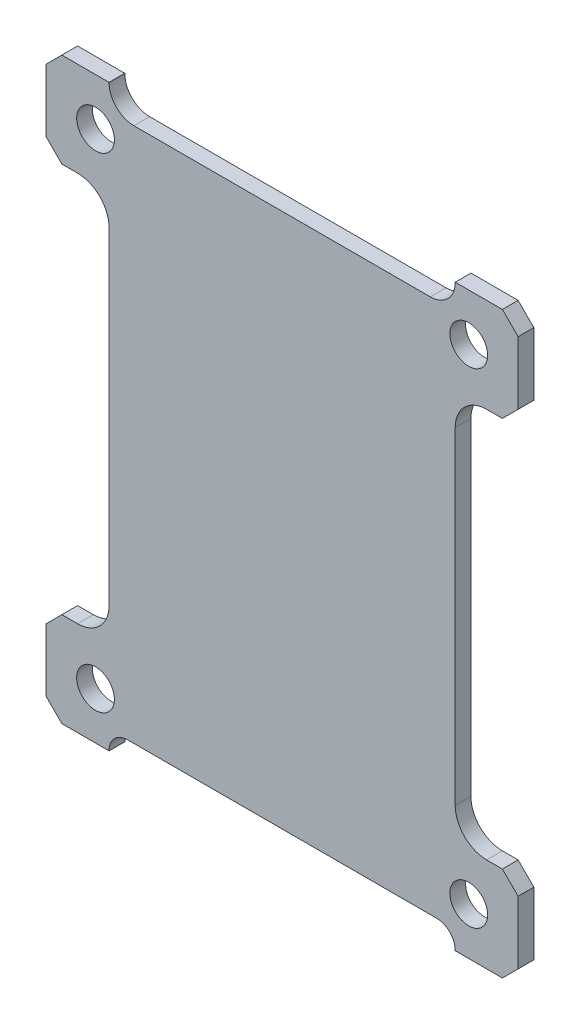
from build123d import *

# Parameters (mm, degrees)
ESBO_O1_R                       = 0.6
RESSALTO_EXTRUS_O1_DEPTH        = 0.5
ESBO_O3_W                       = 4
ESBO_O3_H                       = 5
RESSALTO_EXTRUS_O2_DEPTH        = 1.5
ESBO_O4_W                       = 1
ESBO_O4_H                       = 0.6
RESSALTO_EXTRUS_O3_DEPTH        = 1
CHANFRO1_SIZE                   = 0.8
PADR_O_LINEAR1_COUNT            = 4
PADR_O_LINEAR1_PITCH            = 1.25
CHANFRO1_OF_PADR_O_LINEAR1_SIZE = 0.8
ESPELHAR1_START                 = -1.1
ESPELHAR1_DEPTH                 = 0.6
ESPELHAR1_START_2               = 0.15
ESPELHAR1_2_DEPTH               = 0.6
ESPELHAR1_START_3               = 1.4
ESPELHAR1_3_DEPTH               = 0.6
ESPELHAR1_START_4               = 2.65
ESPELHAR1_4_DEPTH               = 0.6
CHANFRO2_SIZE                   = 0.2


# Read off the part's stored shape, not the designer's step: Espelhar1
with BuildPart() as part:
    # Esboço1 → Ressalto-extrusão1 (new body)
    with BuildSketch(Plane.XY):
        with BuildLine():
            Line((-7, 9.2), (-5.5, 9.2))
            Line((-5.5, 9.2), (-5.5, 9.19))
            ThreePointArc((-5.5, 9.19), (-5.268614357, 8.631385643), (-4.71, 8.4))
            Line((-4.71, 8.4), (4.71, 8.4))
            ThreePointArc((4.71, 8.4), (5.268614357, 8.631385643), (5.5, 9.19))
            Line((5.5, 9.19), (5.5, 9.2))
            Line((5.5, 9.2), (7, 9.2))
            Line((7, 9.2), (7.5, 8.7))
            Line((7.5, 8.7), (7.5, 6.7))
            Line((7.5, 6.7), (7, 6.2))
            Line((7, 6.2), (6.5, 6.2))
            ThreePointArc((6.5, 6.2), (5.792893219, 5.907106781), (5.5, 5.2))
            Line((5.5, 5.2), (5.5, -5.2))
            ThreePointArc((5.5, -5.2), (5.792893219, -5.907106781), (6.5, -6.2))
            Line((6.5, -6.2), (7, -6.2))
            Line((7, -6.2), (7.5, -6.7))
            Line((7.5, -6.7), (7.5, -8.7))
            Line((7.5, -8.7), (7, -9.2))
            Line((7, -9.2), (5.5, -9.2))
            Line((5.5, -9.2), (5.5, -9.19))
            ThreePointArc((5.5, -9.19), (5.327193001, -8.772806999), (4.91, -8.6))
            Line((4.91, -8.6), (-4.91, -8.6))
            ThreePointArc((-4.91, -8.6), (-5.327193001, -8.772806999), (-5.5, -9.19))
            Line((-5.5, -9.19), (-5.5, -9.2))
            Line((-5.5, -9.2), (-7, -9.2))
            Line((-7, -9.2), (-7.5, -8.7))
            Line((-7.5, -8.7), (-7.5, -6.7))
            Line((-7.5, -6.7), (-7, -6.2))
            Line((-7, -6.2), (-6.5, -6.2))
            ThreePointArc((-6.5, -6.2), (-5.792893219, -5.907106781), (-5.5, -5.2))
            Line((-5.5, -5.2), (-5.5, 5.2))
            ThreePointArc((-5.5, 5.2), (-5.792893219, 5.907106781), (-6.5, 6.2))
            Line((-6.5, 6.2), (-7, 6.2))
            Line((-7, 6.2), (-7.5, 6.7))
            Line((-7.5, 6.7), (-7.5, 8.7))
            Line((-7.5, 8.7), (-7, 9.2))
        make_face()
        with Locations((-5.93, 7.7)):
            Circle(ESBO_O1_R, mode=Mode.SUBTRACT)
        with Locations(Location((5.93, 7.7, 0), (0, 0, 180))):
            Circle(ESBO_O1_R, mode=Mode.SUBTRACT)
        with Locations(Location((-5.93, -7.7, 0), (0, 0, 180))):
            Circle(ESBO_O1_R, mode=Mode.SUBTRACT)
        with Locations((5.93, -7.7)):
            Circle(ESBO_O1_R, mode=Mode.SUBTRACT)
    extrude(amount=RESSALTO_EXTRUS_O1_DEPTH)

    # Esboço3 → Ressalto-extrusão2 (add)
    with BuildSketch(Plane(origin=(0, 0, 0), x_dir=(-1, 0, 0), z_dir=(0, 0, -1))):
        with Locations((-0.5, 1.05)):
            Rectangle(ESBO_O3_W, ESBO_O3_H)
    extrude(amount=RESSALTO_EXTRUS_O2_DEPTH)

    # Esboço4 → Ressalto-extrusão3 (add)
    with BuildSketch(Plane(origin=(0, 0, 0), x_dir=(-1, 0, 0), z_dir=(0, 0, -1))):
        with Locations((2, 2.95)):
            Rectangle(ESBO_O4_W, ESBO_O4_H)
    ressalto_extrus_o3 = extrude(amount=RESSALTO_EXTRUS_O3_DEPTH)

    # Chanfro1
    chanfro1_edges = [part.edges().sort_by_distance(p)[0] for p in [
        (-2.5, 2.95, -1),
    ]]
    chamfer(chanfro1_edges, length=CHANFRO1_SIZE)

    # Padrão linear1: Ressalto-extrusão3 ×4
    with Locations(*[(0, -i * PADR_O_LINEAR1_PITCH, 0) for i in range(1, PADR_O_LINEAR1_COUNT)]):
        add(ressalto_extrus_o3)

    # Chanfro1 of Padrão linear1
    chanfro1_of_padr_o_linear1_edges = [part.edges().sort_by_distance(p)[0] for p in [
        (-2.5, 1.7, -1),
        (-2.5, 0.45, -1),
        (-2.5, -0.8, -1),
    ]]
    chamfer(chanfro1_of_padr_o_linear1_edges, length=CHANFRO1_OF_PADR_O_LINEAR1_SIZE)

    # Espelhar1 outline → Espelhar1 (add)
    with BuildSketch(Plane(origin=(0, 0, 0), x_dir=(1, 0, 0), z_dir=(0, 1, 0)).offset(ESPELHAR1_START)):
        Polygon((3.5, 0.2), (2.7, 1), (2.5, 1), (2.5, 0), (3.5, 0), align=None)
    extrude(amount=ESPELHAR1_DEPTH)

    # Espelhar1 2 outline → Espelhar1 2 (add)
    with BuildSketch(Plane(origin=(0, 0, 0), x_dir=(1, 0, 0), z_dir=(0, 1, 0)).offset(ESPELHAR1_START_2)):
        Polygon((3.5, 0.2), (2.7, 1), (2.5, 1), (2.5, 0), (3.5, 0), align=None)
    extrude(amount=ESPELHAR1_2_DEPTH)

    # Espelhar1 3 outline → Espelhar1 3 (add)
    with BuildSketch(Plane(origin=(0, 0, 0), x_dir=(1, 0, 0), z_dir=(0, 1, 0)).offset(ESPELHAR1_START_3)):
        Polygon((3.5, 0.2), (2.7, 1), (2.5, 1), (2.5, 0), (3.5, 0), align=None)
    extrude(amount=ESPELHAR1_3_DEPTH)

    # Espelhar1 4 outline → Espelhar1 4 (add)
    with BuildSketch(Plane(origin=(0, 0, 0), x_dir=(1, 0, 0), z_dir=(0, 1, 0)).offset(ESPELHAR1_START_4)):
        Polygon((3.5, 0.2), (2.7, 1), (2.5, 1), (2.5, 0), (3.5, 0), align=None)
    extrude(amount=ESPELHAR1_4_DEPTH)

    # Chanfro2
    chanfro2_edges = [part.edges().sort_by_distance(p)[0] for p in [
        (2.5, 1.05, -1.5),
        (0.5, -1.45, -1.5),
        (-1.5, 1.05, -1.5),
        (0.5, 3.55, -1.5),
    ]]
    chamfer(chanfro2_edges, length=CHANFRO2_SIZE)


solid = part.part
